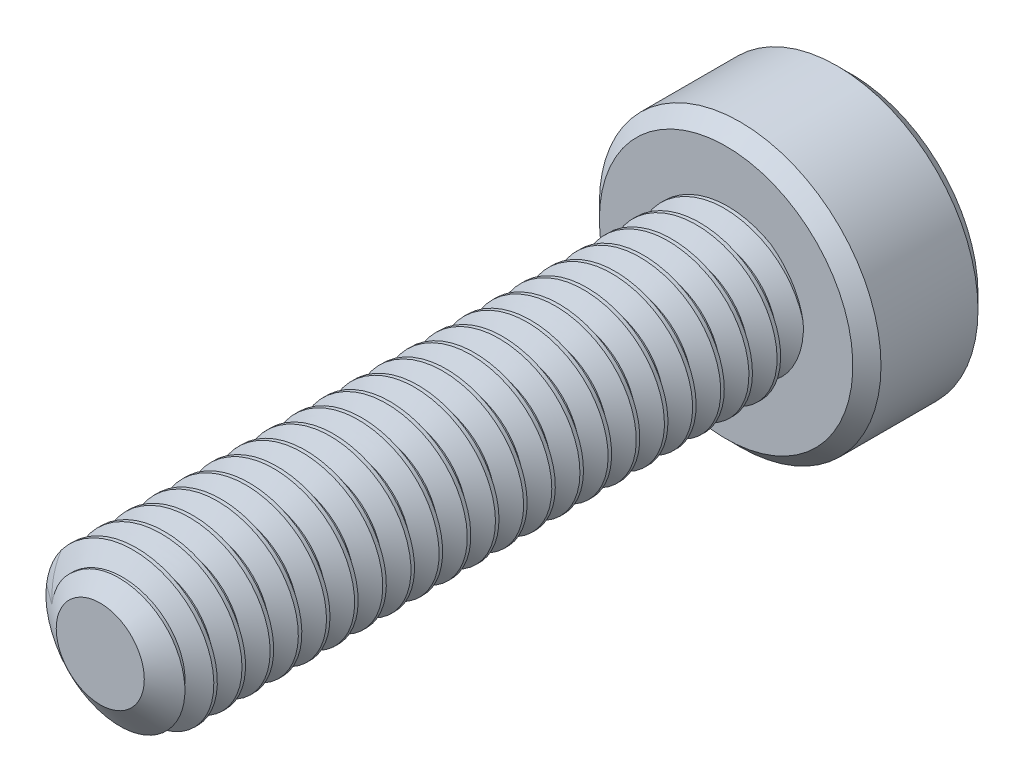
from build123d import *

# Parameters (mm, degrees)
SKETCH1_R          = 1.25
EXTRUDE1_DEPTH     = 10
CUT_SWEEP1_PITCH   = 0.45
SKETCH6_R          = 2.25
EXTRUDE2_DEPTH     = 2
CUT_EXTRUDE1_DEPTH = 1.125
CHAMFER1_SIZE      = 0.225


with BuildPart() as part:
    # Sketch1 → Extrude1 (new body)
    with BuildSketch(Plane.XY):
        Circle(SKETCH1_R)
    extrude(amount=-EXTRUDE1_DEPTH)

    # Cut-Sweep1: the profile of Sketch3 profile screwed along a right-hand helix of 23.222222 turns, 6 arcs to a turn; built about Z, then put on its axis
    cut_sweep1_z = Axis((0, 0, 0), (0, 0, 1))
    cut_sweep1_corners = [(1.2503, 0, -0.393923205), (0.957716426, 0, -0.225), (0.957716426, 0, -0.16875), (1.2503, 0, 0.000173205)]
    with BuildLine(mode=Mode.PRIVATE) as cut_sweep1_profile:
        Line(cut_sweep1_corners[0], cut_sweep1_corners[1])
        Line(cut_sweep1_corners[1], cut_sweep1_corners[2])
        Line(cut_sweep1_corners[2], cut_sweep1_corners[3])
        Line(cut_sweep1_corners[3], cut_sweep1_corners[0])
    cut_sweep1_cap = Face(cut_sweep1_profile.wire())
    cut_sweep1_turn_angles = [0, 30, 60, 90, 120, 150, 180, 210, 240, 270, 300, 330, 360]
    cut_sweep1_turn_weights = [1, 0.8660254037844387, 1, 0.8660254037844387, 1, 0.8660254037844387, 1, 0.8660254037844387, 1, 0.8660254037844387, 1, 0.8660254037844387, 1]
    cut_sweep1_turn_rails = [Edge.make_bspline([Vector(p[0], p[1], 0).rotate(cut_sweep1_z, cut_sweep1_turn_angles[k]) / cut_sweep1_turn_weights[k] + Vector(0, 0, p[2] + CUT_SWEEP1_PITCH * cut_sweep1_turn_angles[k] / 360) for k in range(13)], [0, 0, 0, 1, 1, 2, 2, 3, 3, 4, 4, 5, 5, 6, 6, 6], 2, cut_sweep1_turn_weights) for p in cut_sweep1_corners]
    cut_sweep1_turn_sides = [Face.make_surface_from_curves(cut_sweep1_turn_rails[p[0]], cut_sweep1_turn_rails[p[1]]) for p in [(0, 1), (1, 2), (2, 3), (3, 0)]]
    cut_sweep1_last_angles = [8280, 8310, 8340, 8350, 8360]
    cut_sweep1_last_weights = [1, 0.8660254037844387, 1, 0.9848077530121667, 1]
    cut_sweep1_last_rails = [Edge.make_bspline([Vector(p[0], p[1], 0).rotate(cut_sweep1_z, cut_sweep1_last_angles[k]) / cut_sweep1_last_weights[k] + Vector(0, 0, p[2] + CUT_SWEEP1_PITCH * cut_sweep1_last_angles[k] / 360) for k in range(5)], [0, 0, 0, 1, 1, 2, 2, 2], 2, cut_sweep1_last_weights) for p in cut_sweep1_corners]
    cut_sweep1_last_sides = [Face.make_surface_from_curves(cut_sweep1_last_rails[p[0]], cut_sweep1_last_rails[p[1]]) for p in [(0, 1), (1, 2), (2, 3), (3, 0)]]
    cut_sweep1 = Plane(origin=(0, 0, 0), x_dir=(0, 1, 0), z_dir=(0, 0, -1)) * Solid(Shell([*[p.moved(Location((0, 0, CUT_SWEEP1_PITCH * i))) for i in range(23) for p in cut_sweep1_turn_sides], *cut_sweep1_last_sides, cut_sweep1_cap, cut_sweep1_cap.rotate(cut_sweep1_z, 8360).moved(Location((0, 0, CUT_SWEEP1_PITCH * 8360 / 360)))]))
    add(cut_sweep1, mode=Mode.SUBTRACT)

    # Sketch4 → Cut-Revolve1 (revolve, cut)
    with BuildSketch(Plane(origin=(0, 0, 0), x_dir=(0, 0, -1), z_dir=(1, 0, 0)), mode=Mode.PRIVATE) as cut_revolve1_sk:
        Polygon((0.382511876, 1.25), (0, 0.703716426), (0, 1.25), align=None)
    revolve(cut_revolve1_sk.sketch.rotate(Axis((0, 0, 0), (0, 0, -1)), 276.971148597), axis=Axis((0, 0, 0), (0, 0, -1)), mode=Mode.SUBTRACT)

    # Sketch6 → Extrude2 (add)
    with BuildSketch(Plane(origin=(0, 0, -10), x_dir=(-1, 0, 0), z_dir=(0, 0, -1))):
        Circle(SKETCH6_R)
    extrude(amount=EXTRUDE2_DEPTH)

    # Sketch7 → Cut-Extrude1 (cut)
    with BuildSketch(Plane(origin=(0, 0, -12), x_dir=(-1, 0, 0), z_dir=(0, 0, -1))):
        Polygon((0, 0.866025404), (-0.75, 0.433012702), (-0.75, -0.433012702), (0, -0.866025404), (0.75, -0.433012702), (0.75, 0.433012702), align=None)
    extrude(amount=-CUT_EXTRUDE1_DEPTH, mode=Mode.SUBTRACT)

    # Cut-Extrude2 cone 1 section (through the dimple's axis) → Cut-Extrude2 (revolve, cut)
    with BuildSketch(Plane(origin=(0, 0, -12), x_dir=(0, 1, 0), z_dir=(1, 0, 0))):
        Polygon((0, 0), (0.866025404, 0), (0, 0.866025404), align=None)
    revolve(axis=Axis((0, 0, -12), (0, 0, 1)), mode=Mode.SUBTRACT)

    # Chamfer1
    chamfer1_edges = [part.edges().sort_by_distance(p)[0] for p in [
        (2.25, 0, -10),
        (2.25, 0, -12),
    ]]
    chamfer(chamfer1_edges, length=CHAMFER1_SIZE)


solid = part.part
